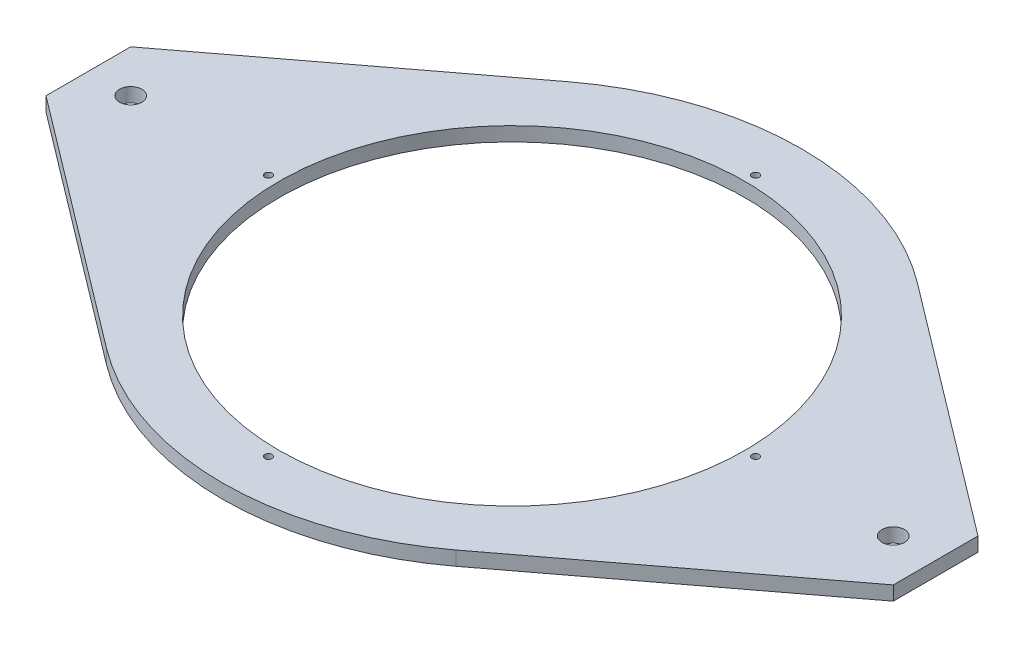
from build123d import *

# Parameters (mm, degrees)
SKETCH1_R               = 104.775
BOSS_EXTRUDE1_DEPTH     = 6.35
F_4_CLEARANCE_HOLE1_D   = 3.2639
F_3_8_CLEARANCE_HOLE1_D = 10.0838


with BuildPart() as part:
    # Sketch1 → Boss-Extrude1 (new body)
    with BuildSketch(Plane(origin=(0, 0, 0), x_dir=(1, 0, 0), z_dir=(0, 1, 0))):
        with BuildLine():
            Line((-190.5, 19.05), (-190.5, -19.05))
            Line((-190.5, -19.05), (-78.57427831, -103.786383563))
            ThreePointArc((-78.57427831, -103.786383563), (0, -130.175), (78.57427831, -103.786383563))
            Line((78.57427831, -103.786383563), (190.5, -19.05))
            Line((190.5, -19.05), (190.5, 19.05))
            Line((190.5, 19.05), (78.57427831, 103.786383563))
            ThreePointArc((78.57427831, 103.786383563), (0, 130.175), (-78.57427831, 103.786383563))
            Line((-78.57427831, 103.786383563), (-190.5, 19.05))
        make_face()
        Circle(SKETCH1_R, mode=Mode.SUBTRACT)
    extrude(amount=BOSS_EXTRUDE1_DEPTH)

    # #4 Clearance Hole1 (through all)
    with Locations(Plane(origin=(0, 6.35, 0), x_dir=(1, 0, 0), z_dir=(0, 1, 0))):
        with Locations((0, 109.5375), (109.5375, 0), (0, -109.5375), (-109.5375, 0)):
            Hole(F_4_CLEARANCE_HOLE1_D / 2)

    # 3/8 Clearance Hole1 (through all)
    with Locations(Plane(origin=(0, 6.35, 0), x_dir=(1, 0, 0), z_dir=(0, 1, 0))):
        with Locations((-171.45, 0), (171.45, 0)):
            Hole(F_3_8_CLEARANCE_HOLE1_D / 2)


solid = part.part
